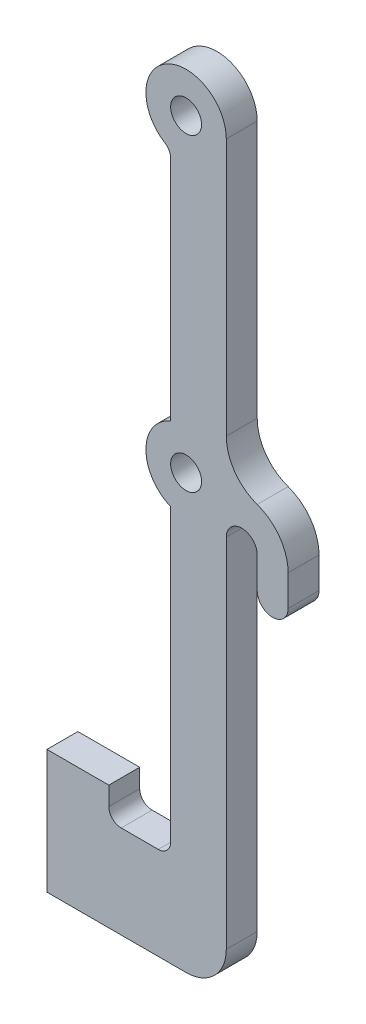
from build123d import *

# Parameters (mm, degrees)
SKETCH1_R           = 3.175
BOSS_EXTRUDE1_DEPTH = 3.175
FILLET1_R           = 2.54
BOSS_EXTRUDE2_DEPTH = 6.35


with BuildPart() as part:
    # Sketch1 → Boss-Extrude1 (new, symmetric)
    with BuildSketch(Plane.XY):
        with BuildLine():
            Line((8.255, -144.145), (8.255, 0))
            ThreePointArc((8.255, 0), (-4.57905012, 6.86857518), (-3.175, -7.62))
            Line((-3.175, -7.62), (-3.175, -55.88))
            ThreePointArc((-3.175, -55.88), (-8.255, -63.5), (-3.175, -71.12))
            Line((-3.175, -71.12), (-3.175, -130.81))
            ThreePointArc((-3.175, -130.81), (-3.918948776, -132.606051224), (-5.715, -133.35))
            Line((-5.715, -133.35), (-13.335, -133.35))
            ThreePointArc((-13.335, -133.35), (-15.131051224, -132.606051224), (-15.875, -130.81))
            Line((-15.875, -130.81), (-15.875, -127))
            Line((-15.875, -127), (-28.575, -127))
            Line((-28.575, -127), (-28.575, -152.4))
            Line((-28.575, -152.4), (0, -152.4))
            ThreePointArc((0, -152.4), (5.837166479, -149.982166479), (8.255, -144.145))
        make_face()
        with Locations((0, -63.5)):
            Circle(SKETCH1_R, mode=Mode.SUBTRACT)
        Circle(SKETCH1_R, mode=Mode.SUBTRACT)
    extrude(amount=BOSS_EXTRUDE1_DEPTH, both=True)

    # Fillet1
    fillet1_edges = [part.edges().sort_by_distance(p)[0] for p in [
        (-3.175, -7.62, 0),
    ]]
    fillet(fillet1_edges, radius=FILLET1_R)

    # Sketch2 → Boss-Extrude2 (add)
    with BuildSketch(Plane.XY.offset(3.175)):
        with BuildLine():
            Line((14.605, -70.822423777), (14.605, -77.172423777))
            ThreePointArc((14.605, -77.172423777), (17.78, -80.347423777), (20.955, -77.172423777))
            Line((20.955, -77.172423777), (20.955, -70.822423777))
            ThreePointArc((20.955, -70.822423777), (19.207129933, -65.323162463), (14.605, -61.842167656))
            ThreePointArc((14.605, -61.842167656), (10.002870067, -58.361172848), (8.255, -52.861911534))
            Line((8.255, -52.861911534), (8.255, -70.822423777))
            ThreePointArc((8.255, -70.822423777), (11.43, -67.647423777), (14.605, -70.822423777))
        make_face()
    extrude(amount=-BOSS_EXTRUDE2_DEPTH)


solid = part.part
